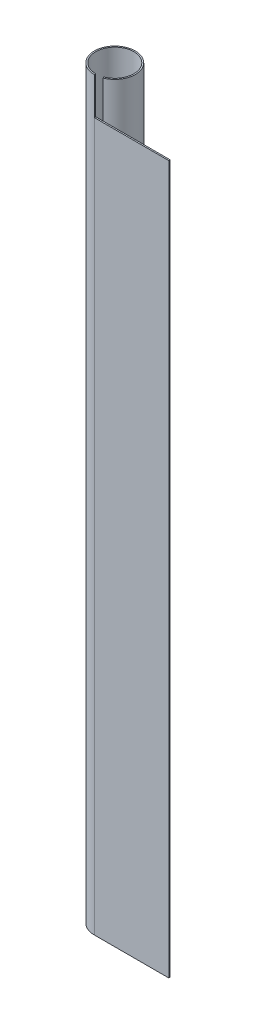
from build123d import *

# Parameters (mm, degrees)
ODGI_CIE_BAZOWE1_DEPTH     = 400
WYTNIJ_WYCI_GNI_CIE1_REACH = 404.597
SZKIC6_W                   = 40
SZKIC6_H                   = 20


# Sheet-metal steps are written as plain solids
with BuildPart() as part:
    # Szkic1 → Odgięcie bazowe1 (new body)
    with BuildSketch(Plane(origin=(0, 0, 0), x_dir=(1, 0, 0), z_dir=(0, 1, 0))):
        with BuildLine():
            ThreePointArc((3.992179856, 0.75), (-2.031009601, 21.810874155), (0, 0))
            Line((0, 0), (40, 0))
            Line((40, 0), (40, 0.7366))
            Line((40, 0.7366), (0, 0.7366))
            ThreePointArc((0, 0.7366), (-1.895005813, 21.08693871), (3.724848976, 1.436377273))
            Line((3.724848976, 1.436377273), (3.992179856, 0.75))
        make_face()
    extrude(amount=-ODGI_CIE_BAZOWE1_DEPTH)

    # Szkic6 → Wytnij-wyciągnięcie1 (cut, up to next)
    with BuildSketch(Plane.XY, mode=Mode.PRIVATE) as wytnij_wyci_gni_cie1_sk1:
        with Locations((20, -10)):
            Rectangle(SZKIC6_W, SZKIC6_H)
    wytnij_wyci_gni_cie1_tool1 = extrude(wytnij_wyci_gni_cie1_sk1.sketch, amount=-WYTNIJ_WYCI_GNI_CIE1_REACH, mode=Mode.PRIVATE) & part.part
    add(wytnij_wyci_gni_cie1_tool1.solids().sort_by_distance((20, -10, 0))[0], mode=Mode.SUBTRACT)


solid = part.part
